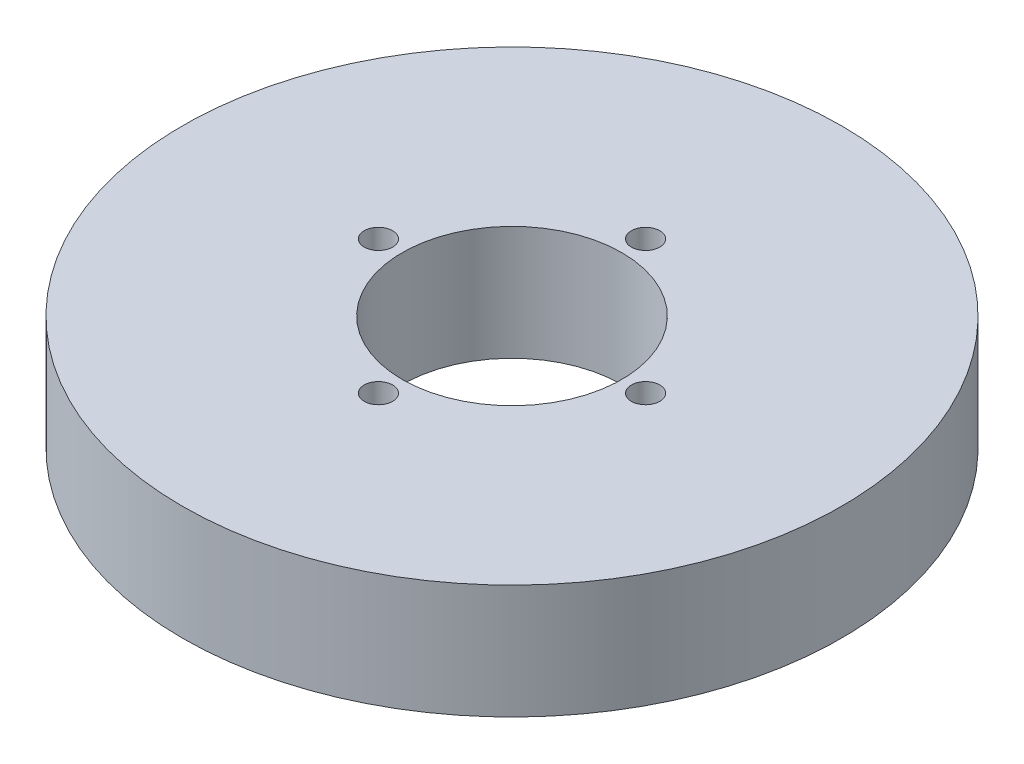
from build123d import *

# Parameters (mm, degrees)
SKETCH1_R           = 37.5
BOSS_EXTRUDE1_DEPTH = 13
SKETCH2_R           = 12.5
CUT_EXTRUDE1_DEPTH  = 55.603113464
SKETCH3_R           = 1.618080347
CUT_EXTRUDE2_DEPTH  = 12.578062534
CIRPATTERN1_COUNT   = 4


with BuildPart() as part:
    # Sketch1 → Boss-Extrude1 (new body)
    with BuildSketch(Plane(origin=(0, 0, 0), x_dir=(1, 0, 0), z_dir=(0, 1, 0))):
        Circle(SKETCH1_R)
    extrude(amount=BOSS_EXTRUDE1_DEPTH)

    # Sketch2 → Cut-Extrude1 (cut, through all)
    with BuildSketch(Plane(origin=(0, 0, 0), x_dir=(1, 0, 0), z_dir=(0, 1, 0))):
        Circle(SKETCH2_R)
    extrude(amount=CUT_EXTRUDE1_DEPTH, mode=Mode.SUBTRACT)

    # Sketch3 → Cut-Extrude2 (cut)
    with BuildSketch(Plane(origin=(0, 13, 0), x_dir=(1, 0, 0), z_dir=(0, 1, 0))):
        with Locations((-15.199366909, 0)):
            Circle(SKETCH3_R)
    cut_extrude2 = extrude(amount=-CUT_EXTRUDE2_DEPTH, mode=Mode.SUBTRACT)

    # CirPattern1: Cut-Extrude2 ×4 about axis
    cirpattern1_axis = Axis((0, 0, 0), (0, 1, 0))
    for i in range(1, CIRPATTERN1_COUNT):
        add(cut_extrude2.rotate(cirpattern1_axis, i * 360 / CIRPATTERN1_COUNT), mode=Mode.SUBTRACT)


solid = part.part
